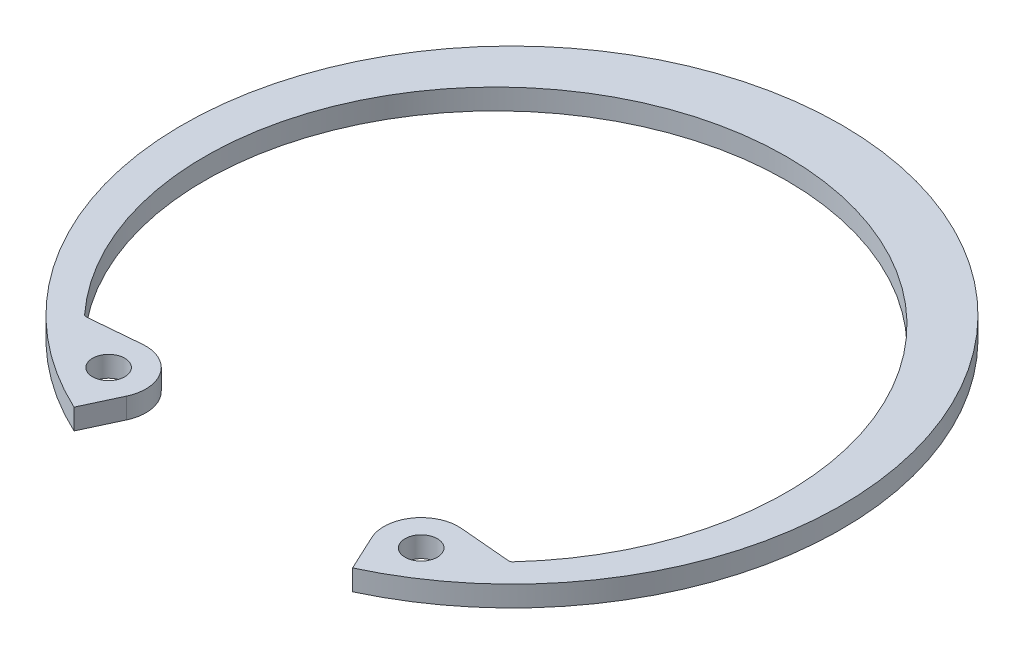
from build123d import *

# Parameters (mm, degrees)
SKETCH2_R      = 0.9906
EXTRUDE1_DEPTH = 1.27
FILLET1_R      = 0.254


with BuildPart() as part:
    # Sketch2 → Extrude1 (new body)
    with BuildSketch(Plane(origin=(0, 0, 0), x_dir=(1, 0, 0), z_dir=(0, 1, 0))):
        with BuildLine():
            Line((8.555399567, -18.347113579), (7.527551211, -16.142885666))
            ThreePointArc((7.527551211, -16.142885666), (7.726789239, -13.865584586), (9.79860884, -12.899479239))
            Line((9.79860884, -12.899479239), (13.072145972, -13.185876628))
            ThreePointArc((13.072145972, -13.185876628), (0, 16.8656), (-13.072145972, -13.185876628))
            Line((-13.072145972, -13.185876628), (-9.79860884, -12.899479239))
            ThreePointArc((-9.79860884, -12.899479239), (-7.726789239, -13.865584586), (-7.527551211, -16.142885666))
            Line((-7.527551211, -16.142885666), (-8.555399567, -18.347113579))
            ThreePointArc((-8.555399567, -18.347113579), (0, 20.2438), (8.555399567, -18.347113579))
        make_face()
        with Locations((9.599370812, -15.176780319)):
            Circle(SKETCH2_R, mode=Mode.SUBTRACT)
        with Locations((-9.599370812, -15.176780319)):
            Circle(SKETCH2_R, mode=Mode.SUBTRACT)
    extrude(amount=-EXTRUDE1_DEPTH)

    # Fillet1
    fillet1_edges = [part.edges().sort_by_distance(p)[0] for p in [
        (-13.072145972, -0.635, 13.185876628),
        (13.072145972, -0.635, 13.185876628),
    ]]
    fillet(fillet1_edges, radius=FILLET1_R)


solid = part.part
